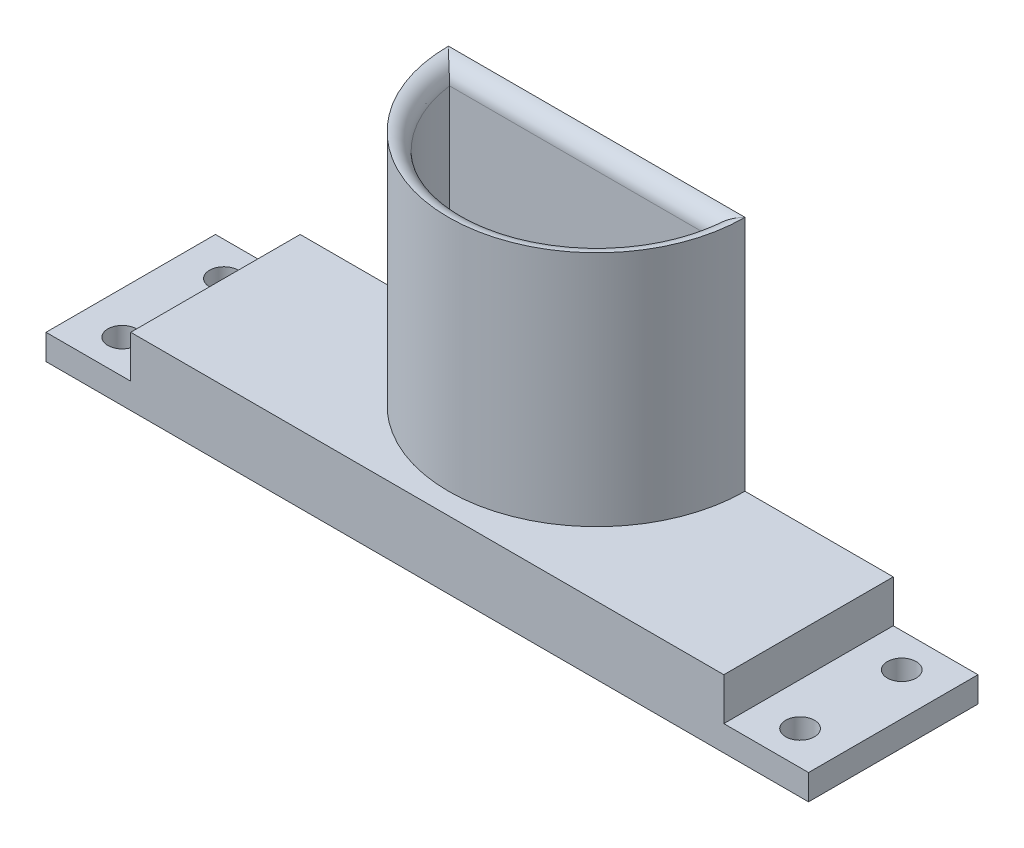
from build123d import *

# Parameters (mm, degrees)
SKETCH1_W                = 70
SKETCH1_H                = 20
BOSS_EXTRUDE1_DEPTH      = 5
SKETCH2_W                = 90
SKETCH2_H                = 20
BOSS_EXTRUDE2_DEPTH      = 3
BOSS_EXTRUDE3_DEPTH      = 28
CUT_EXTRUDE1_DEPTH       = 59.489315264
FILLET1_R                = 2
FILLET2_R                = 2
M3_CLEARANCE_HOLE1_D     = 3.4
M3_CLEARANCE_HOLE1_DEPTH = 10
M3_CLEARANCE_HOLE1_TIP   = 1.021463052


with BuildPart() as part:
    # Sketch1 → Boss-Extrude1 (new body)
    with BuildSketch(Plane(origin=(0, 0, 0), x_dir=(1, 0, 0), z_dir=(0, 1, 0))):
        Rectangle(SKETCH1_W, SKETCH1_H)
    extrude(amount=BOSS_EXTRUDE1_DEPTH)

    # Sketch2 → Boss-Extrude2 (add)
    with BuildSketch(Plane.XZ):
        Rectangle(SKETCH2_W, SKETCH2_H)
    extrude(amount=BOSS_EXTRUDE2_DEPTH)

    # Sketch4 → Boss-Extrude3 (add)
    with BuildSketch(Plane(origin=(0, 5, 0), x_dir=(1, 0, 0), z_dir=(0, 1, 0))):
        with BuildLine():
            Line((17.5, 10), (-17.5, 10))
            ThreePointArc((-17.5, 10), (0, -7.5), (17.5, 10))
        make_face()
    extrude(amount=BOSS_EXTRUDE3_DEPTH)

    # Sketch6 → Cut-Extrude1 (cut, through all)
    with BuildSketch(Plane(origin=(0, 33, 0), x_dir=(1, 0, 0), z_dir=(0, 1, 0))):
        with BuildLine():
            Line((15.370426149, 8), (-15.370426149, 8))
            ThreePointArc((-15.370426149, 8), (0, -5.5), (15.370426149, 8))
        make_face()
    extrude(amount=-CUT_EXTRUDE1_DEPTH, mode=Mode.SUBTRACT)

    # Fillet1
    fillet1_edges = [part.edges().sort_by_distance(p)[0] for p in [
        (0, 33, 5.5),
        (0, 33, -8),
    ]]
    fillet(fillet1_edges, radius=FILLET1_R - 0.0001)  # a hair under: the kernel refuses the full size

    # Fillet2
    fillet2_edges = [part.edges().sort_by_distance(p)[0] for p in [
        (0, -3, 5.5),
        (0, -3, -8),
    ]]
    fillet(fillet2_edges, radius=FILLET2_R - 0.0001)  # a hair under: the kernel refuses the full size

    # M3 Clearance Hole1
    with Locations(Plane(origin=(0, 0, 0), x_dir=(1, 0, 0), z_dir=(0, 1, 0))):
        with Locations((-40, 6), (-40, -6), (40, 6), (40, -6)):
            Hole(M3_CLEARANCE_HOLE1_D / 2, depth=M3_CLEARANCE_HOLE1_DEPTH)
            with Locations((0, 0, -(M3_CLEARANCE_HOLE1_DEPTH + M3_CLEARANCE_HOLE1_TIP / 2))):  # 118° drill point
                Cone(0, M3_CLEARANCE_HOLE1_D / 2, M3_CLEARANCE_HOLE1_TIP, mode=Mode.SUBTRACT)


solid = part.part
